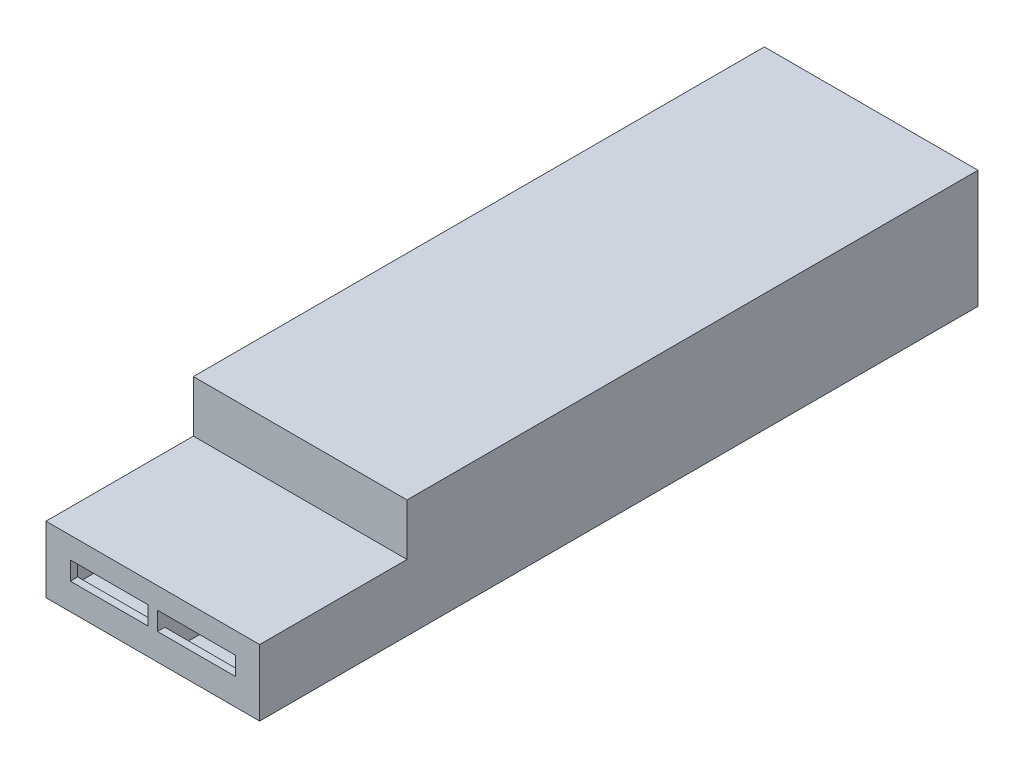
from build123d import *

# Parameters (mm, degrees)
SKETCH1_W           = 58
SKETCH1_H           = 18
SKETCH1_W_2         = 21.15
SKETCH1_H_2         = 5
BOSS_EXTRUDE1_DEPTH = 40
SKETCH2_W           = 58
SKETCH2_H           = 32
BOSS_EXTRUDE2_DEPTH = 155
CUT_EXTRUDE1_START  = 2
SKETCH3_W           = 55
SKETCH3_H           = 16.5
CUT_EXTRUDE1_DEPTH  = 39
SKETCH4_W           = 2.5
SKETCH4_H           = 16.5
BOSS_EXTRUDE3_DEPTH = 20
FILLET1_R           = 1.25
SKETCH5_W           = 55
SKETCH5_H           = 29
CUT_EXTRUDE2_DEPTH  = 153.5
SKETCH6_W           = 55
SKETCH6_H           = 16.5
CUT_EXTRUDE3_DEPTH  = 153.5


with BuildPart() as part:
    # Sketch1 → Boss-Extrude1 (new body)
    with BuildSketch(Plane.XY):
        Rectangle(SKETCH1_W, SKETCH1_H)
        with Locations((-11.825, 0.7)):
            Rectangle(SKETCH1_W_2, SKETCH1_H_2, mode=Mode.SUBTRACT)
        with Locations((11.825, 0.7)):
            Rectangle(SKETCH1_W_2, SKETCH1_H_2, mode=Mode.SUBTRACT)
    extrude(amount=BOSS_EXTRUDE1_DEPTH)

    # Sketch2 → Boss-Extrude2 (add)
    with BuildSketch(Plane(origin=(0, 0, 0), x_dir=(-1, 0, 0), z_dir=(0, 0, -1))):
        with Locations((0, 7)):
            Rectangle(SKETCH2_W, SKETCH2_H)
    extrude(amount=BOSS_EXTRUDE2_DEPTH)

    # Sketch3 → Cut-Extrude1 (cut)
    with BuildSketch(Plane(origin=(0, 0, 40), x_dir=(-1, 0, 0), z_dir=(0, 0, -1)).offset(CUT_EXTRUDE1_START)):
        Rectangle(SKETCH3_W, SKETCH3_H)
    extrude(amount=CUT_EXTRUDE1_DEPTH, mode=Mode.SUBTRACT)

    # Sketch4 → Boss-Extrude3 (add)
    with BuildSketch(Plane(origin=(0, 0, 40), x_dir=(-1, 0, 0), z_dir=(0, 0, -1))):
        Rectangle(SKETCH4_W, SKETCH4_H)
    extrude(amount=BOSS_EXTRUDE3_DEPTH)

    # Fillet1
    fillet1_edges = [part.edges().sort_by_distance(p)[0] for p in [
        (1.25, 0, 20),
        (-1.25, 0, 20),
    ]]
    fillet(fillet1_edges, radius=FILLET1_R - 0.0001)  # a hair under: the kernel refuses the full size

    # Sketch5 → Cut-Extrude2 (cut)
    with BuildSketch(Plane(origin=(0, 0, -155), x_dir=(-1, 0, 0), z_dir=(0, 0, -1))):
        with Locations((0, 7)):
            Rectangle(SKETCH5_W, SKETCH5_H)
    extrude(amount=-CUT_EXTRUDE2_DEPTH, mode=Mode.SUBTRACT)

    # Sketch6 → Cut-Extrude3 (cut)
    with BuildSketch(Plane.XY.offset(-1)):
        Rectangle(SKETCH6_W, SKETCH6_H)
    extrude(amount=-CUT_EXTRUDE3_DEPTH, mode=Mode.SUBTRACT)


solid = part.part
